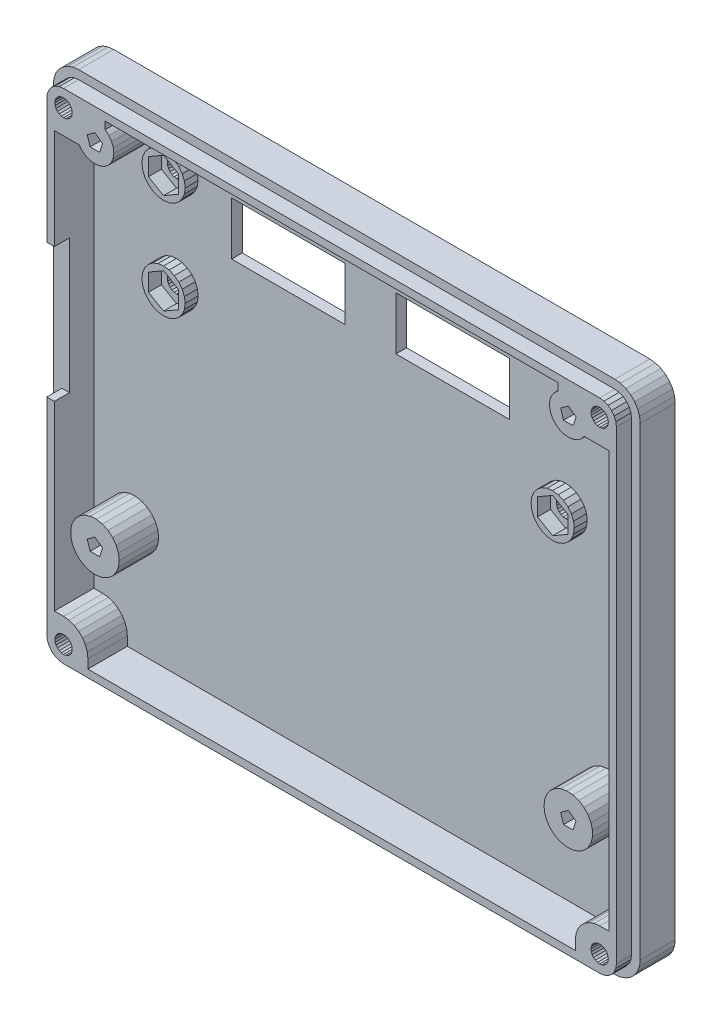
from build123d import *

# Parameters (mm, degrees)
BOSS_EXTRUDE1_DEPTH = 6.475530648
BOSS_EXTRUDE2_DEPTH = 2.800001144
CUT_EXTRUDE1_DEPTH  = 4.500000119
BOSS_EXTRUDE3_DEPTH = 7.300001264
CUT_EXTRUDE2_DEPTH  = 74.423509677
BOSS_EXTRUDE4_DEPTH = 2.39996922
CUT_EXTRUDE3_DEPTH  = 2.39996922
CUT_EXTRUDE4_DEPTH  = 74.423509677
SKETCH9_W           = 20.999999046
SKETCH9_H           = 9.799995422
CUT_EXTRUDE5_DEPTH  = 74.423509677
BOSS_EXTRUDE5_DEPTH = 7.300001264
CUT_EXTRUDE6_DEPTH  = 74.423509677
BOSS_EXTRUDE6_DEPTH = 2.39996922
CUT_EXTRUDE7_DEPTH  = 2.39996922
CUT_EXTRUDE8_DEPTH  = 74.423509677
CUT_EXTRUDE9_DEPTH  = 5.975530648
CUT_EXTRUDE10_DEPTH = 74.42350968
CUT_EXTRUDE11_DEPTH = 5.975530648
CUT_EXTRUDE12_DEPTH = 74.42350968
CUT_EXTRUDE13_DEPTH = 74.42350968
CUT_EXTRUDE14_DEPTH = 5.975530648
CUT_EXTRUDE15_DEPTH = 74.42350968
CUT_EXTRUDE16_DEPTH = 5.975530648
CUT_EXTRUDE17_DEPTH = 74.42350968
CUT_EXTRUDE18_DEPTH = 74.423509677
BOSS_EXTRUDE7_DEPTH = 2.39996922
CUT_EXTRUDE19_DEPTH = 2.39996922
CUT_EXTRUDE20_DEPTH = 74.423509677
SKETCH28_W          = 21.000001907
SKETCH28_H          = 9.799995422
CUT_EXTRUDE21_DEPTH = 74.200179659
DRAFT1_ANGLE        = 40.17264527
DRAFT2_ANGLE        = 40.172991818
DRAFT3_ANGLE        = 40.172674537
DRAFT4_ANGLE        = 40.172833177
DRAFT5_ANGLE        = 17.99998572
DRAFT6_ANGLE        = 17.99998572


with BuildPart() as part:
    # Sketch1 → Boss-Extrude1 (new body)
    with BuildSketch(Plane.XY.offset(6.475530624)):
        Polygon((52.825393677, -47.186252594), (53.569602966, -46.442047119), (54.129550934, -45.550899506), (54.477157593, -44.557491302), (54.594997406, -43.511642456), (54.594997406, 42.488365173), (54.477157593, 43.534210205), (54.129550934, 44.527618408), (53.569602966, 45.418762207), (52.825393677, 46.162971497), (51.934253693, 46.722919464), (50.94084549, 47.070526123), (49.895000458, 47.188362122), (-49.305007935, 47.188362122), (-50.350856781, 47.070526123), (-51.344261169, 46.722919464), (-52.235408783, 46.162971497), (-52.979614258, 45.418762207), (-53.539562225, 44.527618408), (-53.887168884, 43.534210205), (-54.005008698, 42.488365173), (-54.005008698, -43.511642456), (-53.887168884, -44.557491302), (-53.539562225, -45.550899506), (-52.979614258, -46.442047119), (-52.235408783, -47.186252594), (-51.344261169, -47.746196747), (-50.350856781, -48.093803406), (-49.305007935, -48.211643219), (49.895000458, -48.211643219), (50.94084549, -48.093803406), (51.934253693, -47.746196747), align=None)
    extrude(amount=-BOSS_EXTRUDE1_DEPTH)

    # Sketch2 → Boss-Extrude2 (add)
    with BuildSketch(Plane.XY.offset(6.475530624)):
        Polygon((-50.107345581, 45.482730865), (-49.305007935, 45.588367462), (49.895000458, 45.588367462), (50.697338104, 45.482730865), (51.44499588, 45.173042297), (52.087028503, 44.68038559), (52.579673767, 44.03836441), (52.88936615, 43.29070282), (52.994998932, 42.488365173), (52.994998932, -43.511642456), (52.88936615, -44.313983917), (52.579673767, -45.061645508), (52.087028503, -45.703670502), (51.44499588, -46.196323395), (50.697338104, -46.506011963), (49.895000458, -46.611644745), (-49.305007935, -46.611644745), (-50.107345581, -46.506011963), (-50.855007172, -46.196323395), (-51.497039795, -45.703670502), (-51.989685059, -45.061645508), (-52.299377441, -44.313983917), (-52.405006409, -43.511642456), (-52.405006409, -5.411629677), (-51.005008698, -5.411629677), (-51.005008698, -39.011642456), (-49.305007935, -39.011642456), (-48.303665161, -39.124465942), (-47.352531433, -39.45728302), (-46.499305725, -39.993396759), (-45.786766052, -40.705936432), (-45.250648499, -41.559165955), (-44.917831421, -42.510295868), (-44.805007935, -43.511642456), (-44.805007935, -45.211643219), (45.394996643, -45.211643219), (45.394996643, -43.511642456), (45.507823944, -42.510295868), (45.840641022, -41.559165955), (46.376754761, -40.705936432), (47.089298248, -39.993396759), (47.942523956, -39.45728302), (48.893657684, -39.124465942), (49.895000458, -39.011642456), (51.594997406, -39.011642456), (51.594997406, 37.988365173), (47.034385681, 37.988365173), (47.034385681, 37.714274245), (45.735122681, 36.796443939), (44.903453827, 36.483013153), (44.019649506, 36.3891716), (43.140705109, 36.520973206), (42.323287964, 36.869915009), (41.620124817, 37.41349411), (41.076545715, 38.116657257), (40.727611542, 38.934066772), (40.595809937, 39.813011169), (40.68964386, 40.696815491), (41.003074646, 41.528491974), (41.920902948, 42.827747345), (42.19499588, 42.827747345), (42.19499588, 44.188365936), (-41.605007172, 44.188365936), (-41.605007172, 42.827747345), (-41.330927895, 42.827747345), (-40.413085938, 41.528491974), (-40.099662781, 40.696815491), (-40.005817413, 39.813011169), (-40.137615204, 38.934066772), (-40.486557007, 38.116657257), (-41.030136108, 37.41349411), (-41.733299255, 36.869915009), (-42.550708771, 36.520973206), (-43.429656982, 36.3891716), (-44.313465118, 36.483013153), (-45.145137787, 36.796443939), (-46.444393158, 37.714274245), (-46.444393158, 37.988365173), (-51.005008698, 37.988365173), (-51.005008698, 19.388345718), (-52.405006409, 19.388345718), (-52.405006409, 42.488365173), (-52.299377441, 43.29070282), (-51.989685059, 44.03836441), (-51.497039795, 44.68038559), (-50.855007172, 45.173042297), align=None)
    extrude(amount=BOSS_EXTRUDE2_DEPTH)

    # Sketch3 → Cut-Extrude1 (cut)
    with BuildSketch(Plane.XY.offset(6.475530624)):
        Polygon((-45.786766052, -40.705936432), (-45.250648499, -41.559165955), (-44.917831421, -42.510295868), (-44.805007935, -43.511642456), (-44.805007935, -45.211643219), (45.394996643, -45.211643219), (45.394996643, -43.511642456), (45.507823944, -42.510295868), (45.840641022, -41.559165955), (46.376754761, -40.705936432), (47.089298248, -39.993396759), (47.942523956, -39.45728302), (48.893657684, -39.124465942), (49.895000458, -39.011642456), (51.594997406, -39.011642456), (51.594997406, 37.988365173), (47.034385681, 37.988365173), (47.034385681, 37.714274245), (45.735122681, 36.796443939), (44.903453827, 36.483013153), (44.019649506, 36.3891716), (43.140705109, 36.520973206), (42.323287964, 36.869915009), (41.620124817, 37.41349411), (41.076545715, 38.116657257), (40.727611542, 38.934066772), (40.595809937, 39.813011169), (40.68964386, 40.696815491), (41.003074646, 41.528491974), (41.920902948, 42.827747345), (42.19499588, 42.827747345), (42.19499588, 44.188365936), (-41.605007172, 44.188365936), (-41.605007172, 42.827747345), (-41.330927895, 42.827747345), (-40.413085938, 41.528491974), (-40.099662781, 40.696815491), (-40.005817413, 39.813011169), (-40.137615204, 38.934066772), (-40.486557007, 38.116657257), (-41.030136108, 37.41349411), (-41.733299255, 36.869915009), (-42.550708771, 36.520973206), (-43.429656982, 36.3891716), (-44.313465118, 36.483013153), (-45.145137787, 36.796443939), (-46.444393158, 37.714274245), (-46.444393158, 37.988365173), (-51.005008698, 37.988365173), (-51.005008698, -39.011642456), (-49.305007935, -39.011642456), (-48.303665161, -39.124465942), (-47.352531433, -39.45728302), (-46.499305725, -39.993396759), align=None)
    extrude(amount=-CUT_EXTRUDE1_DEPTH, mode=Mode.SUBTRACT)

    # Sketch4 → Boss-Extrude3 (add)
    with BuildSketch(Plane.XY.offset(1.975530505)):
        Polygon((46.011005402, -28.983366013), (44.938209534, -29.33193779), (43.81244278, -29.402765274), (42.704421997, -29.191396713), (41.68378067, -28.711120605), (40.81463623, -27.992105484), (40.151622772, -27.079536438), (39.736377716, -26.03074646), (39.594997406, -24.911643982), (39.736377716, -23.792537689), (40.151622772, -22.743751526), (40.81463623, -21.83118248), (41.68378067, -21.112167358), (42.704421997, -20.631889343), (43.81244278, -20.42052269), (44.938209534, -20.491348267), (46.011005402, -20.839920044), (46.963405609, -21.44433403), (47.73557663, -22.266609192), (48.278991699, -23.255081177), (48.559513092, -24.347642899), (48.559513092, -25.475645065), (48.278991699, -26.568206787), (47.73557663, -27.556678772), (46.963405609, -28.378953934), align=None)
    extrude(amount=BOSS_EXTRUDE3_DEPTH)

    # Sketch5 → Cut-Extrude2 (cut, through all)
    with BuildSketch(Plane(origin=(0, 0, 0), x_dir=(-1, 0, 0), z_dir=(0, 0, -1))):
        Polygon((-44.976669312, -26.125167847), (-43.213317871, -26.125167847), (-42.66841507, -24.448116302), (-44.094997406, -23.411640167), (-45.521575928, -24.448116302), align=None)
    extrude(amount=-CUT_EXTRUDE2_DEPTH, mode=Mode.SUBTRACT)

    # Sketch6 → Boss-Extrude4 (add)
    with BuildSketch(Plane.XY.offset(1.975530505)):
        Polygon((39.123435974, 14.659895897), (38.295005798, 14.024219513), (37.330287933, 13.624614716), (36.295009613, 13.488313675), (35.259735107, 13.624614716), (34.295001984, 14.024219513), (33.466579437, 14.659895897), (32.830913544, 15.488318443), (32.431308746, 16.453048706), (32.295005798, 17.488313675), (32.431308746, 18.523593903), (32.830913544, 19.48831749), (33.466579437, 20.316747665), (34.295001984, 20.952423096), (35.259735107, 21.352027893), (36.295009613, 21.488313675), (37.330287933, 21.352027893), (38.295005798, 20.952423096), (39.123435974, 20.316747665), (39.759109497, 19.48831749), (40.158714294, 18.523593903), (40.295009613, 17.488313675), (40.158714294, 16.453048706), (39.759109497, 15.488318443), align=None)
    extrude(amount=BOSS_EXTRUDE4_DEPTH)

    # Sketch7 → Cut-Extrude3 (cut)
    with BuildSketch(Plane.XY.offset(4.375499725)):
        Polygon((36.295009613, 14.255157471), (39.09500885, 15.871739388), (39.09500885, 19.104904175), (36.295009613, 20.721477509), (33.495014191, 19.104904175), (33.495014191, 15.871739388), align=None)
    extrude(amount=-CUT_EXTRUDE3_DEPTH, mode=Mode.SUBTRACT)

    # Sketch8 → Cut-Extrude4 (cut, through all)
    with BuildSketch(Plane(origin=(0, 0, 0), x_dir=(-1, 0, 0), z_dir=(0, 0, -1))):
        Polygon((-37.937080383, 17.048324585), (-37.767250061, 16.638313293), (-37.497093201, 16.286235809), (-37.145015717, 16.016069412), (-36.73500061, 15.846240997), (-36.295009613, 15.788320541), (-35.85502243, 15.846240997), (-35.445007324, 16.016069412), (-35.092922211, 16.286235809), (-34.82276535, 16.638313293), (-34.652931213, 17.048324585), (-34.59500885, 17.488311768), (-34.652931213, 17.92830658), (-34.82276535, 18.338319778), (-35.092922211, 18.690402985), (-35.445007324, 18.960561752), (-35.85502243, 19.130390167), (-36.295009613, 19.188318253), (-36.73500061, 19.130390167), (-37.145015717, 18.960561752), (-37.497093201, 18.690402985), (-37.767250061, 18.338319778), (-37.937080383, 17.92830658), (-37.995014191, 17.488311768), align=None)
    extrude(amount=-CUT_EXTRUDE4_DEPTH, mode=Mode.SUBTRACT)

    # Sketch9 → Cut-Extrude5 (cut, through all)
    with BuildSketch(Plane(origin=(0, 0, 0), x_dir=(-1, 0, 0), z_dir=(0, 0, -1))):
        with Locations((-15.39499712, 31.38835907)):
            Rectangle(SKETCH9_W, SKETCH9_H)
    extrude(amount=-CUT_EXTRUDE5_DEPTH, mode=Mode.SUBTRACT)

    # Sketch10 → Boss-Extrude5 (add)
    with BuildSketch(Plane.XY.offset(1.975530505)):
        Polygon((-43.222450256, -29.402765274), (-44.348220825, -29.33193779), (-45.421016693, -28.983366013), (-46.373416901, -28.378953934), (-47.145584106, -27.556678772), (-47.689002991, -26.568206787), (-47.969524384, -25.475645065), (-47.969524384, -24.347642899), (-47.689002991, -23.255081177), (-47.145584106, -22.266609192), (-46.373416901, -21.44433403), (-45.421016693, -20.839920044), (-44.348220825, -20.491348267), (-43.222450256, -20.42052269), (-42.114433289, -20.631889343), (-41.093784332, -21.112167358), (-40.224643707, -21.83118248), (-39.561626434, -22.743751526), (-39.146381378, -23.792537689), (-39.005008698, -24.911643982), (-39.146381378, -26.03074646), (-39.561626434, -27.079536438), (-40.224643707, -27.992105484), (-41.093784332, -28.711120605), (-42.114433289, -29.191396713), align=None)
    extrude(amount=BOSS_EXTRUDE5_DEPTH)

    # Sketch11 → Cut-Extrude6 (cut, through all)
    with BuildSketch(Plane(origin=(0, 0, 0), x_dir=(-1, 0, 0), z_dir=(0, 0, -1))):
        Polygon((44.386684418, -26.125167847), (44.386684418, -24.052217174), (43.505004883, -23.411640167), (42.623329163, -24.052217174), (42.623329163, -26.125167847), align=None)
    extrude(amount=-CUT_EXTRUDE6_DEPTH, mode=Mode.SUBTRACT)

    # Sketch12 → Boss-Extrude6 (add)
    with BuildSketch(Plane.XY.offset(1.975530505)):
        Polygon((-35.704998016, 13.488313675), (-36.740268707, 13.624614716), (-37.704994202, 14.024219513), (-38.533424377, 14.659895897), (-39.169094086, 15.488318443), (-39.568695068, 16.453048706), (-39.704998016, 17.488313675), (-39.568695068, 18.523593903), (-39.169094086, 19.48831749), (-38.533424377, 20.316747665), (-37.704994202, 20.952423096), (-36.740268707, 21.352027893), (-35.704998016, 21.488313675), (-34.669715881, 21.352027893), (-33.704994202, 20.952423096), (-32.876567841, 20.316747665), (-32.240894318, 19.48831749), (-31.84128952, 18.523593903), (-31.704996109, 17.488313675), (-31.84128952, 16.453048706), (-32.240894318, 15.488318443), (-32.876567841, 14.659895897), (-33.704994202, 14.024219513), (-34.669715881, 13.624614716), align=None)
    extrude(amount=BOSS_EXTRUDE6_DEPTH)

    # Sketch13 → Cut-Extrude7 (cut)
    with BuildSketch(Plane.XY.offset(4.375499725)):
        Polygon((-38.504993439, 15.871739388), (-35.704998016, 14.255157471), (-32.904994965, 15.871739388), (-32.904994965, 19.104904175), (-35.704998016, 20.721477509), (-38.504993439, 19.104904175), align=None)
    extrude(amount=-CUT_EXTRUDE7_DEPTH, mode=Mode.SUBTRACT)

    # Sketch14 → Cut-Extrude8 (cut, through all)
    with BuildSketch(Plane(origin=(0, 0, 0), x_dir=(-1, 0, 0), z_dir=(0, 0, -1))):
        Polygon((34.502910614, 16.286235809), (34.854991913, 16.016069412), (35.265003204, 15.846240997), (35.704998016, 15.788320541), (36.144981384, 15.846240997), (36.554992676, 16.016069412), (36.907073975, 16.286235809), (37.177238464, 16.638313293), (37.347068787, 17.048324585), (37.404994965, 17.488311768), (37.347068787, 17.92830658), (37.177238464, 18.338319778), (36.907073975, 18.690402985), (36.554992676, 18.960561752), (36.144981384, 19.130390167), (35.704998016, 19.188318253), (35.265003204, 19.130390167), (34.854991913, 18.960561752), (34.502910614, 18.690402985), (34.232749939, 18.338319778), (34.062919617, 17.92830658), (34.004993439, 17.488311768), (34.062919617, 17.048324585), (34.232749939, 16.638313293), align=None)
    extrude(amount=-CUT_EXTRUDE8_DEPTH, mode=Mode.SUBTRACT)

    # Sketch15 → Cut-Extrude9 (cut)
    with BuildSketch(Plane(origin=(0, 0, 0), x_dir=(-1, 0, 0), z_dir=(0, 0, -1))):
        Polygon((-52.696186066, -44.262214661), (-52.406471252, -44.961647034), (-51.945602417, -45.562252045), (-51.344993591, -46.023117065), (-50.645572662, -46.312831879), (-49.895000458, -46.411640167), (-49.144420624, -46.312831879), (-48.44499588, -46.023117065), (-47.84438324, -45.562252045), (-47.383522034, -44.961647034), (-47.093811035, -44.262214661), (-46.994995117, -43.511642456), (-47.093811035, -42.761074066), (-47.383522034, -42.061641693), (-47.84438324, -41.461036682), (-48.44499588, -41.000171661), (-49.144420624, -40.710456848), (-49.895000458, -40.61164856), (-50.645572662, -40.710456848), (-51.344993591, -41.000171661), (-51.945602417, -41.461036682), (-52.406471252, -42.061641693), (-52.696186066, -42.761074066), (-52.794998169, -43.511642456), align=None)
    extrude(amount=-CUT_EXTRUDE9_DEPTH, mode=Mode.SUBTRACT)

    # Sketch16 → Cut-Extrude10 (cut, through all)
    with BuildSketch(Plane.XY.offset(9.275531769)):
        Polygon((51.280643463, -44.311641693), (51.440479279, -43.925754547), (51.494995117, -43.511642456), (51.440479279, -43.09753418), (51.280643463, -42.711643219), (51.026371002, -42.380271912), (50.694992065, -42.125999451), (50.309108734, -41.966163635), (49.895000458, -41.911643982), (49.480888367, -41.966163635), (49.094993591, -42.125999451), (48.763629913, -42.380271912), (48.509357452, -42.711643219), (48.349510193, -43.09753418), (48.295001984, -43.511642456), (48.349510193, -43.925754547), (48.509357452, -44.311641693), (48.763629913, -44.643013), (49.094993591, -44.897281647), (49.480888367, -45.057125092), (49.895000458, -45.11164093), (50.309108734, -45.057125092), (50.694992065, -44.897281647), (51.026371002, -44.643013), align=None)
    extrude(amount=-CUT_EXTRUDE10_DEPTH, mode=Mode.SUBTRACT)

    # Sketch17 → Cut-Extrude11 (cut)
    with BuildSketch(Plane(origin=(0, 0, 0), x_dir=(-1, 0, 0), z_dir=(0, 0, -1))):
        Polygon((-52.715373993, 43.163246155), (-52.794116974, 42.416751862), (-52.678611755, 41.675037384), (-52.376609802, 40.98783493), (-51.908348083, 40.401161194), (-51.305194855, 39.954319), (-50.607551575, 39.677261353), (-49.862178802, 39.588546753), (-49.118999481, 39.694114685), (-48.42780304, 39.9868927), (-47.834915161, 40.447265625), (-47.057571411, 41.889183044), (-46.998832703, 42.637519836), (-47.134143829, 43.375865936), (-47.454414368, 44.054748535), (-47.938209534, 44.628688812), (-48.553104401, 45.05921936), (-49.257907867, 45.317516327), (-50.005393982, 45.386260986), (-50.745483398, 45.260845184), (-51.428588867, 44.949687958), (-52.008953094, 44.473609924), (-52.447673798, 43.864524841), align=None)
    extrude(amount=-CUT_EXTRUDE11_DEPTH, mode=Mode.SUBTRACT)

    # Sketch18 → Cut-Extrude12 (cut, through all)
    with BuildSketch(Plane.XY.offset(9.275531769)):
        Polygon((51.440479279, 42.074249268), (51.494995117, 42.488365173), (51.440479279, 42.902477264), (51.280643463, 43.288356781), (51.026371002, 43.619735718), (50.694992065, 43.874004364), (50.309108734, 44.033847809), (49.895000458, 44.088363647), (49.480888367, 44.033847809), (49.094993591, 43.874004364), (48.763629913, 43.619735718), (48.509357452, 43.288356781), (48.349510193, 42.902477264), (48.295001984, 42.488365173), (48.349510193, 42.074249268), (48.509357452, 41.688362122), (48.763629913, 41.356987), (49.094993591, 41.102722168), (49.480888367, 40.942878723), (49.895000458, 40.888362885), (50.309108734, 40.942878723), (50.694992065, 41.102722168), (51.026371002, 41.356987), (51.280643463, 41.688362122), align=None)
    extrude(amount=-CUT_EXTRUDE12_DEPTH, mode=Mode.SUBTRACT)

    # Sketch19 → Cut-Extrude13 (cut, through all)
    with BuildSketch(Plane.XY.offset(9.275531769)):
        Polygon((44.976669312, 38.67483902), (45.521583557, 40.351890564), (44.094997406, 41.388362885), (42.66841507, 40.351890564), (43.213317871, 38.67483902), align=None)
    extrude(amount=-CUT_EXTRUDE13_DEPTH, mode=Mode.SUBTRACT)

    # Sketch20 → Cut-Extrude14 (cut)
    with BuildSketch(Plane(origin=(0, 0, 0), x_dir=(-1, 0, 0), z_dir=(0, 0, -1))):
        Polygon((52.205005646, 42.488365173), (52.106193542, 43.238937378), (51.816482544, 43.938362122), (51.355617523, 44.538974762), (50.755008698, 44.999832153), (50.055583954, 45.289546967), (49.305007935, 45.388355255), (48.554431915, 45.289546967), (47.855007172, 44.999832153), (47.254398346, 44.538974762), (46.79353714, 43.938362122), (46.503822327, 43.238937378), (46.405006409, 42.488365173), (46.503822327, 41.737789154), (46.79353714, 41.03836441), (47.254398346, 40.43775177), (47.855007172, 39.976886749), (48.554431915, 39.687179565), (49.305007935, 39.588363647), (50.055583954, 39.687179565), (50.755008698, 39.976886749), (51.355617523, 40.43775177), (51.816482544, 41.03836441), (52.106193542, 41.737789154), align=None)
    extrude(amount=-CUT_EXTRUDE14_DEPTH, mode=Mode.SUBTRACT)

    # Sketch21 → Cut-Extrude15 (cut, through all)
    with BuildSketch(Plane.XY.offset(9.275531769)):
        Polygon((-50.436378479, 43.619735718), (-50.690647125, 43.288356781), (-50.850486755, 42.902477264), (-50.905006409, 42.488365173), (-50.850486755, 42.074249268), (-50.690647125, 41.688362122), (-50.436378479, 41.356987), (-50.105010986, 41.102722168), (-49.719116211, 40.942878723), (-49.305007935, 40.888362885), (-48.890895844, 40.942878723), (-48.505008698, 41.102722168), (-48.17363739, 41.356987), (-47.919364929, 41.688362122), (-47.759525299, 42.074249268), (-47.705005646, 42.488365173), (-47.759525299, 42.902477264), (-47.919364929, 43.288356781), (-48.17363739, 43.619735718), (-48.505008698, 43.874004364), (-48.890895844, 44.033847809), (-49.305007935, 44.088363647), (-49.719116211, 44.033847809), (-50.105010986, 43.874004364), align=None)
    extrude(amount=-CUT_EXTRUDE15_DEPTH, mode=Mode.SUBTRACT)

    # Sketch22 → Cut-Extrude16 (cut)
    with BuildSketch(Plane(origin=(0, 0, 0), x_dir=(-1, 0, 0), z_dir=(0, 0, -1))):
        Polygon((47.254398346, -45.562252045), (47.855007172, -46.023117065), (48.554431915, -46.312831879), (49.305007935, -46.411640167), (50.055583954, -46.312831879), (50.755008698, -46.023117065), (51.355617523, -45.562252045), (51.816482544, -44.961647034), (52.106193542, -44.262214661), (52.205005646, -43.511642456), (52.106193542, -42.761074066), (51.816482544, -42.061641693), (51.355617523, -41.461036682), (50.755008698, -41.000171661), (50.055583954, -40.710456848), (49.305007935, -40.61164856), (48.554431915, -40.710456848), (47.855007172, -41.000171661), (47.254398346, -41.461036682), (46.79353714, -42.061641693), (46.503822327, -42.761074066), (46.405006409, -43.511642456), (46.503822327, -44.262214661), (46.79353714, -44.961647034), align=None)
    extrude(amount=-CUT_EXTRUDE16_DEPTH, mode=Mode.SUBTRACT)

    # Sketch23 → Cut-Extrude17 (cut, through all)
    with BuildSketch(Plane.XY.offset(9.275531769)):
        Polygon((-48.505008698, -44.897281647), (-48.17363739, -44.643013), (-47.919364929, -44.311641693), (-47.759525299, -43.925754547), (-47.705005646, -43.511642456), (-47.759525299, -43.09753418), (-47.919364929, -42.711643219), (-48.17363739, -42.380271912), (-48.505008698, -42.125999451), (-48.890895844, -41.966163635), (-49.305007935, -41.911643982), (-49.719116211, -41.966163635), (-50.105010986, -42.125999451), (-50.436378479, -42.380271912), (-50.690647125, -42.711643219), (-50.850486755, -43.09753418), (-50.905006409, -43.511642456), (-50.850486755, -43.925754547), (-50.690647125, -44.311641693), (-50.436378479, -44.643013), (-50.105010986, -44.897281647), (-49.719116211, -45.057125092), (-49.305007935, -45.11164093), (-48.890895844, -45.057125092), align=None)
    extrude(amount=-CUT_EXTRUDE17_DEPTH, mode=Mode.SUBTRACT)

    # Sketch24 → Cut-Extrude18 (cut, through all)
    with BuildSketch(Plane(origin=(0, 0, 0), x_dir=(-1, 0, 0), z_dir=(0, 0, -1))):
        Polygon((42.623329163, 40.747788235), (42.623329163, 38.67483902), (44.386684418, 38.67483902), (44.386684418, 40.747788235), (43.505004883, 41.388362885), align=None)
    extrude(amount=-CUT_EXTRUDE18_DEPTH, mode=Mode.SUBTRACT)

    # Sketch25 → Boss-Extrude7 (add)
    with BuildSketch(Plane.XY.offset(1.975530505)):
        Polygon((-31.84128952, 37.029830933), (-31.704996109, 35.994552612), (-31.84128952, 34.959278107), (-32.240894318, 33.994556427), (-32.876567841, 33.166133881), (-33.704994202, 32.530456543), (-34.669715881, 32.130851746), (-35.704998016, 31.994550705), (-36.740268707, 32.130851746), (-37.704994202, 32.530456543), (-38.533424377, 33.166133881), (-39.169094086, 33.994556427), (-39.568695068, 34.959278107), (-39.704998016, 35.994552612), (-39.568695068, 37.029830933), (-39.169094086, 37.994556427), (-38.533424377, 38.822986603), (-37.704994202, 39.458656311), (-36.740268707, 39.858261108), (-35.704998016, 39.994552612), (-34.669715881, 39.858261108), (-33.704994202, 39.458656311), (-32.876567841, 38.822986603), (-32.240894318, 37.994556427), align=None)
    extrude(amount=BOSS_EXTRUDE7_DEPTH)

    # Sketch26 → Cut-Extrude19 (cut)
    with BuildSketch(Plane.XY.offset(4.375499725)):
        Polygon((-38.504993439, 34.377975464), (-35.704998016, 32.761386871), (-32.904994965, 34.377975464), (-32.904994965, 37.611133575), (-35.704998016, 39.227718353), (-38.504993439, 37.611133575), align=None)
    extrude(amount=-CUT_EXTRUDE19_DEPTH, mode=Mode.SUBTRACT)

    # Sketch27 → Cut-Extrude20 (cut, through all)
    with BuildSketch(Plane(origin=(0, 0, 0), x_dir=(-1, 0, 0), z_dir=(0, 0, -1))):
        Polygon((36.144981384, 34.352481842), (36.554992676, 34.52230835), (36.907073975, 34.792476654), (37.177238464, 35.144554138), (37.347068787, 35.55456543), (37.404994965, 35.994552612), (37.347068787, 36.434547424), (37.177238464, 36.844558716), (36.907073975, 37.1966362), (36.554992676, 37.46679306), (36.144981384, 37.636631012), (35.704998016, 37.69455719), (35.265003204, 37.636631012), (34.854991913, 37.46679306), (34.502910614, 37.1966362), (34.232749939, 36.844558716), (34.062919617, 36.434547424), (34.004993439, 35.994552612), (34.062919617, 35.55456543), (34.232749939, 35.144554138), (34.502910614, 34.792476654), (34.854991913, 34.52230835), (35.265003204, 34.352481842), (35.704998016, 34.294551849), align=None)
    extrude(amount=-CUT_EXTRUDE20_DEPTH, mode=Mode.SUBTRACT)

    # Sketch28 → Cut-Extrude21 (cut, through all)
    with BuildSketch(Plane.XY.offset(1.975530505)):
        with Locations((-15.005005837, 31.38835907)):
            Rectangle(SKETCH28_W, SKETCH28_H)
    extrude(amount=-CUT_EXTRUDE21_DEPTH, mode=Mode.SUBTRACT)

    # Draft1
    draft1_faces = [part.faces().sort_by_distance(p)[0] for p in [
        (-46.444393158, 37.851319709, 5.625531137),
    ]]
    draft(draft1_faces, Plane(origin=(-46.444393158, 37.988365173, 9.275531769), x_dir=(-1, 0, 0), z_dir=(0, -1, 0)), DRAFT1_ANGLE)

    # Draft2
    draft2_faces = [part.faces().sort_by_distance(p)[0] for p in [
        (-41.467967533, 42.827747345, 5.625531137),
    ]]
    draft(draft2_faces, Plane(origin=(-41.605007172, 44.188365936, 9.275531769), x_dir=(0, 0, 1), z_dir=(1, 0, 0)), DRAFT2_ANGLE)

    # Draft3
    draft3_faces = [part.faces().sort_by_distance(p)[0] for p in [
        (42.057949414, 42.827747345, 5.625531137),
    ]]
    draft(draft3_faces, Plane(origin=(42.19499588, 42.827747345, 9.275531769), x_dir=(0, 0, -1), z_dir=(-1, 0, 0)), DRAFT3_ANGLE)

    # Draft4
    draft4_faces = [part.faces().sort_by_distance(p)[0] for p in [
        (47.034385681, 37.851319709, 5.625531137),
    ]]
    draft(draft4_faces, Plane(origin=(51.594997406, 37.988365173, 9.275531769), x_dir=(0, 0, -1), z_dir=(0, -1, 0)), DRAFT4_ANGLE)

    # Draft5
    draft5_faces = [part.faces().sort_by_distance(p)[0] for p in [
        (-44.386684418, 39.711313628, 4.637765884),
        (-42.623329163, 39.711313628, 4.637765884),
    ]]
    draft(draft5_faces, Plane(origin=(-42.623329163, 38.67483902, 9.275531769), x_dir=(0, 0, 1), z_dir=(0, 1, 0)), DRAFT5_ANGLE)

    # Draft6
    draft6_faces = [part.faces().sort_by_distance(p)[0] for p in [
        (-42.623329163, -25.08869251, 4.637765884),
        (-44.386684418, -25.08869251, 4.637765884),
    ]]
    draft(draft6_faces, Plane(origin=(-42.623329163, -26.125167847, 9.275531769), x_dir=(0, 0, 1), z_dir=(0, 1, 0)), DRAFT6_ANGLE)


solid = part.part
